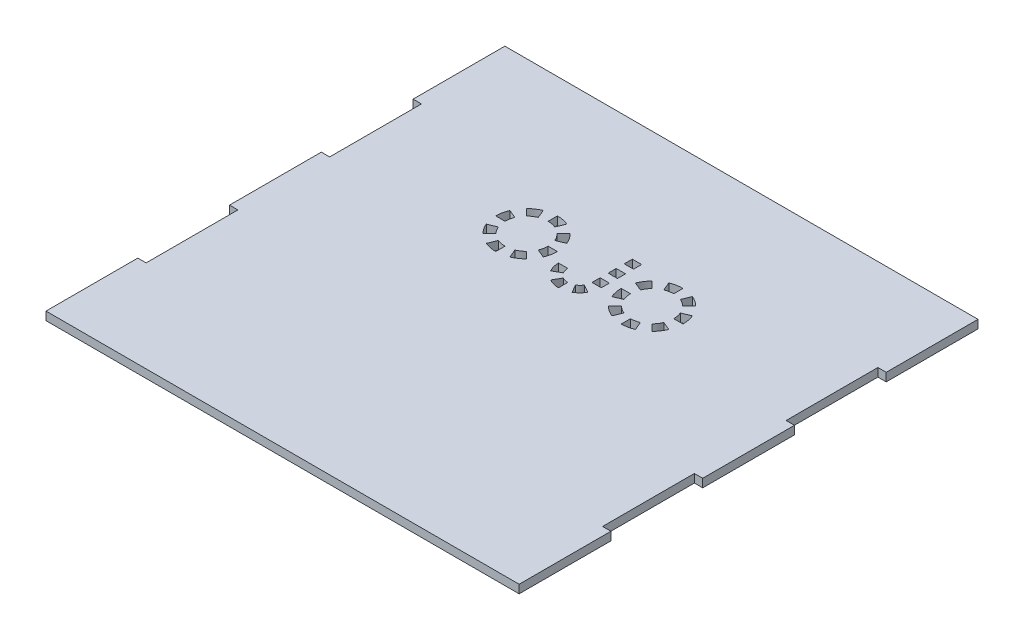
from build123d import *

# Parameters (mm, degrees)
BOSS_EXTRUDE1_DEPTH = 2.7


with BuildPart() as part:
    # Sketch1 → Boss-Extrude1 (new body)
    with BuildSketch(Plane(origin=(0, 0, 0), x_dir=(1, 0, 0), z_dir=(0, 1, 0))):
        Polygon((76.7, -74.385), (-76.7, -74.385), (-76.7, -44.631), (-74, -44.631), (-74, -14.877), (-76.7, -14.877), (-76.7, 14.877), (-74, 14.877), (-74, 44.631), (-76.7, 44.631), (-76.7, 74.385), (76.7, 74.385), (76.7, 44.631), (74, 44.631), (74, 14.877), (76.7, 14.877), (76.7, -14.877), (74, -14.877), (74, -44.631), (76.7, -44.631), align=None)
        with BuildLine():
            Line((-13.441997927, 18.164873803), (-15.563318271, 20.286194147))
            ThreePointArc((-15.563318271, 20.286194147), (-16.624074108, 19.415654329), (-17.834281713, 18.768784888))
            Line((-17.834281713, 18.768784888), (-16.686231415, 15.99714629))
            ThreePointArc((-16.686231415, 15.99714629), (-14.957363409, 16.921245492), (-13.441997927, 18.164873803))
        make_face(mode=Mode.SUBTRACT)
        with BuildLine():
            Line((-11.274270414, 21.409107292), (-14.045909011, 22.557157589))
            ThreePointArc((-14.045909011, 22.557157589), (-13.647568776, 23.870309361), (-13.513065739, 25.235941615))
            Line((-13.513065739, 25.235941615), (-10.513065739, 25.235941615))
            ThreePointArc((-10.513065739, 25.235941615), (-10.705212935, 23.285038395), (-11.274270414, 21.409107292))
        make_face(mode=Mode.SUBTRACT)
        with BuildLine():
            Line((-11.274270414, 29.062775939), (-14.045909011, 27.914725642))
            ThreePointArc((-14.045909011, 27.914725642), (-14.692778453, 29.124933246), (-15.563318271, 30.185689083))
            Line((-15.563318271, 30.185689083), (-13.441997927, 32.307009427))
            ThreePointArc((-13.441997927, 32.307009427), (-12.198369616, 30.791643945), (-11.274270414, 29.062775939))
        make_face(mode=Mode.SUBTRACT)
        with BuildLine():
            Line((-16.686231415, 34.47473694), (-17.834281713, 31.703098343))
            ThreePointArc((-17.834281713, 31.703098343), (-19.147433485, 32.101438578), (-20.513065739, 32.235941615))
            Line((-20.513065739, 32.235941615), (-20.513065739, 35.235941615))
            ThreePointArc((-20.513065739, 35.235941615), (-18.562162519, 35.043794419), (-16.686231415, 34.47473694))
        make_face(mode=Mode.SUBTRACT)
        with BuildLine():
            Line((-23.191849766, 31.703098343), (-24.339900063, 34.47473694))
            ThreePointArc((-24.339900063, 34.47473694), (-26.068768069, 33.550637738), (-27.584133551, 32.307009427))
            Line((-27.584133551, 32.307009427), (-25.462813207, 30.185689083))
            ThreePointArc((-25.462813207, 30.185689083), (-24.40205737, 31.056228901), (-23.191849766, 31.703098343))
        make_face(mode=Mode.SUBTRACT)
        with BuildLine():
            Line((-26.980222467, 27.914725642), (-29.751861064, 29.062775939))
            ThreePointArc((-29.751861064, 29.062775939), (-30.320918543, 27.186844835), (-30.513065739, 25.235941615))
            Line((-30.513065739, 25.235941615), (-27.513065739, 25.235941615))
            ThreePointArc((-27.513065739, 25.235941615), (-27.378562702, 26.601573869), (-26.980222467, 27.914725642))
        make_face(mode=Mode.SUBTRACT)
        with BuildLine():
            Line((-26.980222467, 22.557157589), (-29.751861064, 21.409107292))
            ThreePointArc((-29.751861064, 21.409107292), (-28.827761862, 19.680239285), (-27.584133551, 18.164873803))
            Line((-27.584133551, 18.164873803), (-25.462813207, 20.286194147))
            ThreePointArc((-25.462813207, 20.286194147), (-26.333353025, 21.346949984), (-26.980222467, 22.557157589))
        make_face(mode=Mode.SUBTRACT)
        with BuildLine():
            Line((-23.191849766, 18.768784888), (-24.339900063, 15.99714629))
            ThreePointArc((-24.339900063, 15.99714629), (-22.463968959, 15.428088811), (-20.513065739, 15.235941615))
            Line((-20.513065739, 15.235941615), (-20.513065739, 18.235941615))
            ThreePointArc((-20.513065739, 18.235941615), (-21.878697993, 18.370444652), (-23.191849766, 18.768784888))
        make_face(mode=Mode.SUBTRACT)
        with BuildLine():
            Line((22.869386326, 18.768784888), (24.017436623, 15.99714629))
            ThreePointArc((24.017436623, 15.99714629), (22.141505519, 15.428088811), (20.190602299, 15.235941615))
            Line((20.190602299, 15.235941615), (20.190602299, 18.235941615))
            ThreePointArc((20.190602299, 18.235941615), (21.556234553, 18.370444652), (22.869386326, 18.768784888))
        make_face(mode=Mode.SUBTRACT)
        with BuildLine():
            Line((26.657759027, 22.557157589), (29.429397624, 21.409107292))
            ThreePointArc((29.429397624, 21.409107292), (28.505298422, 19.680239285), (27.261670111, 18.164873803))
            Line((27.261670111, 18.164873803), (25.140349768, 20.286194147))
            ThreePointArc((25.140349768, 20.286194147), (26.010889585, 21.346949984), (26.657759027, 22.557157589))
        make_face(mode=Mode.SUBTRACT)
        with BuildLine():
            Line((26.657759027, 27.914725642), (29.429397624, 29.062775939))
            ThreePointArc((29.429397624, 29.062775939), (29.998455103, 27.186844835), (30.190602299, 25.235941615))
            Line((30.190602299, 25.235941615), (27.190602299, 25.235941615))
            ThreePointArc((27.190602299, 25.235941615), (27.056099262, 26.601573869), (26.657759027, 27.914725642))
        make_face(mode=Mode.SUBTRACT)
        with BuildLine():
            Line((22.869386326, 31.703098343), (24.017436623, 34.47473694))
            ThreePointArc((24.017436623, 34.47473694), (25.746304629, 33.550637738), (27.261670111, 32.307009427))
            Line((27.261670111, 32.307009427), (25.140349768, 30.185689083))
            ThreePointArc((25.140349768, 30.185689083), (24.07959393, 31.056228901), (22.869386326, 31.703098343))
        make_face(mode=Mode.SUBTRACT)
        with BuildLine():
            Line((16.363767976, 34.47473694), (17.511818273, 31.703098343))
            ThreePointArc((17.511818273, 31.703098343), (18.824970045, 32.101438578), (20.190602299, 32.235941615))
            Line((20.190602299, 32.235941615), (20.190602299, 35.235941615))
            ThreePointArc((20.190602299, 35.235941615), (18.239699079, 35.043794419), (16.363767976, 34.47473694))
        make_face(mode=Mode.SUBTRACT)
        with BuildLine():
            Line((10.951806974, 29.062775939), (13.723445572, 27.914725642))
            ThreePointArc((13.723445572, 27.914725642), (14.370315013, 29.124933246), (15.240854831, 30.185689083))
            Line((15.240854831, 30.185689083), (13.119534487, 32.307009427))
            ThreePointArc((13.119534487, 32.307009427), (11.875906176, 30.791643945), (10.951806974, 29.062775939))
        make_face(mode=Mode.SUBTRACT)
        with BuildLine():
            Line((10.951806974, 21.409107292), (13.723445572, 22.557157589))
            ThreePointArc((13.723445572, 22.557157589), (13.325105336, 23.870309361), (13.190602299, 25.235941615))
            Line((13.190602299, 25.235941615), (10.190602299, 25.235941615))
            ThreePointArc((10.190602299, 25.235941615), (10.382749495, 23.285038395), (10.951806974, 21.409107292))
        make_face(mode=Mode.SUBTRACT)
        with BuildLine():
            Line((13.119534487, 18.164873803), (15.240854831, 20.286194147))
            ThreePointArc((15.240854831, 20.286194147), (16.301610668, 19.415654329), (17.511818273, 18.768784888))
            Line((17.511818273, 18.768784888), (16.363767976, 15.99714629))
            ThreePointArc((16.363767976, 15.99714629), (14.634899969, 16.921245492), (13.119534487, 18.164873803))
        make_face(mode=Mode.SUBTRACT)
        with BuildLine():
            Line((-7.103331206, 22.179000364), (-4.100272392, 22.179000364))
            ThreePointArc((-4.100272392, 22.179000364), (-3.966020147, 21.159253326), (-3.572412483, 20.209000364))
            Line((-3.572412483, 20.209000364), (-6.173137705, 18.707470956))
            ThreePointArc((-6.173137705, 18.707470956), (-6.866752214, 20.382004511), (-7.103331206, 22.179000364))
        make_face(mode=Mode.SUBTRACT)
        Polygon((6.782786423, 35.235941615), (3.769169666, 35.235941615), (3.771281254, 32.624553365), (6.782786423, 32.624553365), align=None, mode=Mode.SUBTRACT)
        Polygon((3.779727608, 22.179000364), (3.77761602, 24.790388614), (6.782786423, 24.790388614), (6.782786423, 22.179000364), align=None, mode=Mode.SUBTRACT)
        Polygon((3.775504431, 27.401776864), (3.773392843, 30.013165115), (6.782786423, 30.013165115), (6.782786423, 27.401776864), align=None, mode=Mode.SUBTRACT)
        with BuildLine():
            Line((-3.631801799, 16.16613505), (-2.130272392, 18.766860273))
            ThreePointArc((-2.130272392, 18.766860273), (-1.18001943, 18.373252608), (-0.160272392, 18.239000364))
            Line((-0.160272392, 18.239000364), (-0.160272392, 15.235941549))
            ThreePointArc((-0.160272392, 15.235941549), (-1.957268244, 15.472520541), (-3.631801799, 16.16613505))
        make_face(mode=Mode.SUBTRACT)
        with BuildLine():
            Line((3.311257015, 16.16613505), (1.809727608, 18.766860273))
            ThreePointArc((1.809727608, 18.766860273), (2.625728326, 19.392999646), (3.251867699, 20.209000364))
            Line((3.251867699, 20.209000364), (5.852592922, 18.707470956))
            ThreePointArc((5.852592922, 18.707470956), (4.749211578, 17.269516394), (3.311257015, 16.16613505))
        make_face(mode=Mode.SUBTRACT)
    extrude(amount=BOSS_EXTRUDE1_DEPTH)


solid = part.part
